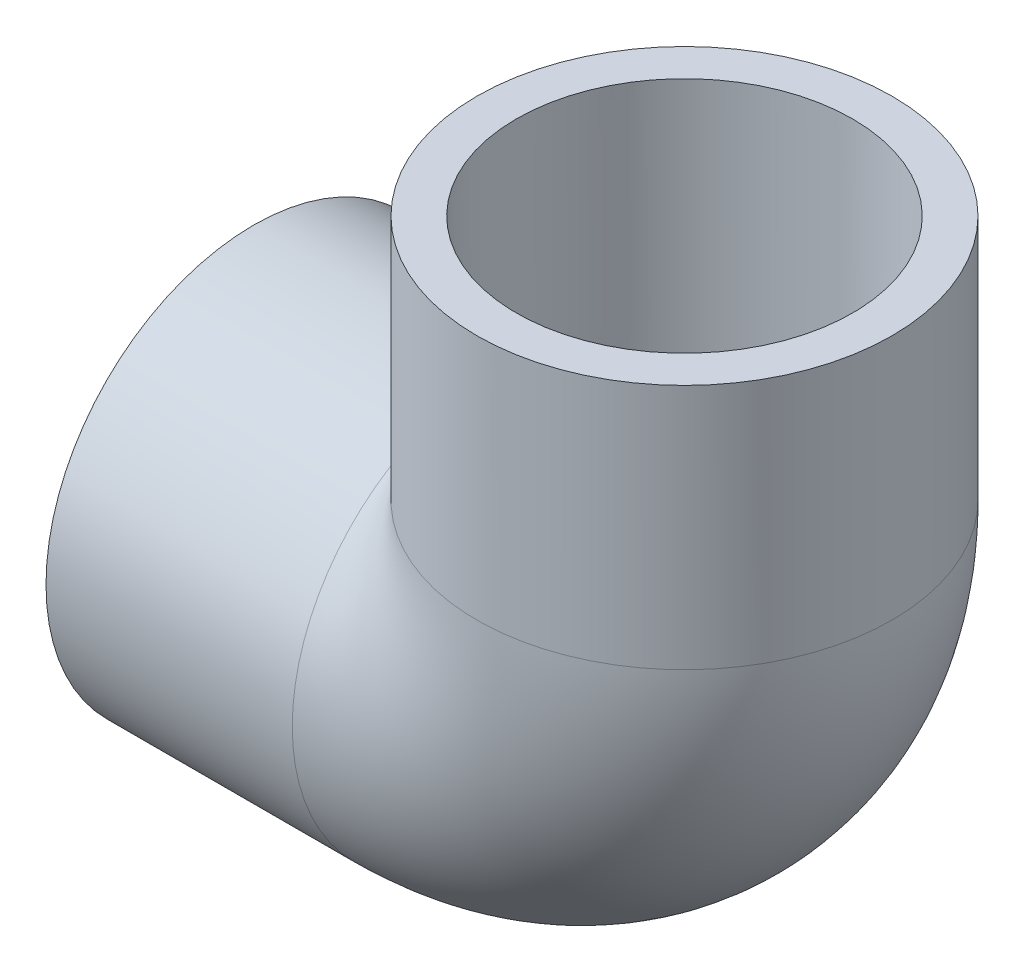
from build123d import *

# Parameters (mm, degrees)
SKETCH3_R   = 29.972
SKETCH3_R_2 = 19.05


with BuildPart() as part:
    # Sketch1 → Revolve1 (revolve)
    with BuildSketch(Plane.XY):
        Polygon((-62.23, -29.972), (-26.67, -29.972), (-26.67, -24.0538), (-62.23, -24.2824), align=None)
    revolve(axis=Axis((-62.23, 0, 0), (1, 0, 0)))


with BuildPart() as body_2:
    # Sketch2 → Revolve2 (revolve)
    with BuildSketch(Plane.XY):
        Polygon((24.2824, 62.23), (24.0538, 26.67), (29.972, 26.67), (29.972, 62.23), align=None)
    revolve(axis=Axis((0, 0, 0), (0, 1, 0)))


with BuildPart() as sweep1_tool:
    # Sweep1: sweep along a path in Sketch4
    with BuildLine(Plane.XY) as sweep1_path:
        ThreePointArc((-26.67, 0), (-7.811462, 7.811462), (0, 26.67))
    # Sketch3 → Sweep1 (sweep)
    with BuildSketch(Plane(origin=(-26.67, 0, 0), x_dir=(0, 0, -1), z_dir=(1, 0, 0))):
        Circle(SKETCH3_R)
        Circle(SKETCH3_R_2, mode=Mode.SUBTRACT)
    sweep(path=sweep1_path.line)


with BuildPart() as part_1:
    add(part.part)


with BuildPart() as part_2:
    # Sweep1: joined with sweep1_tool
    add(part_1.part.fuse(sweep1_tool.part, body_2.part, tol=0.00001))


solid = part_2.part
